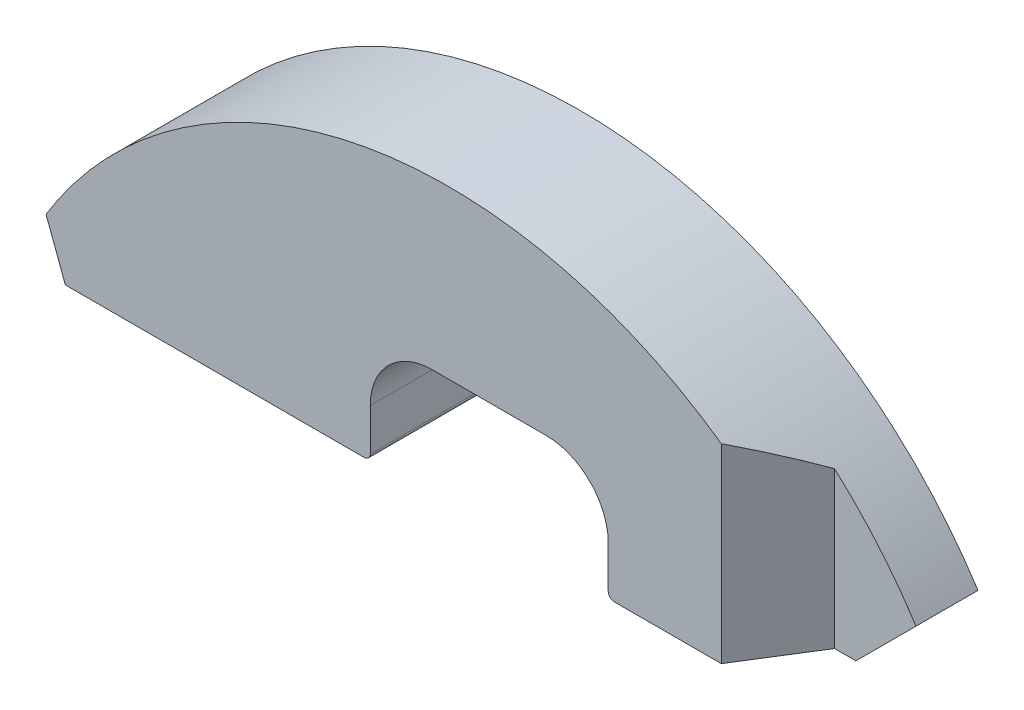
from build123d import *

# Parameters (mm, degrees)
BOSS_EXTRUDE1_DEPTH = 53.975
FILLET1_R           = 25.4
FILLET2_R           = 2.54
CHAMFER1_SIZE       = 38.1
CHAMFER2_SIZE       = 19.17726945
CUT_EXTRUDE2_DEPTH  = 221.930957303


with BuildPart() as part:
    # Sketch1 → Boss-Extrude1 (new body)
    with BuildSketch(Plane.XY):
        with BuildLine():
            Line((-48.768, 0), (-48.768, 45.106))
            Line((-48.768, 45.106), (48.768, 45.106))
            Line((48.768, 45.106), (48.768, 0))
            Line((48.768, 0), (159.817162922, 0))
            ThreePointArc((159.817162922, 0), (-16.571441881, 113.499698272), (-192.960046685, 0))
            Line((-192.960046685, 0), (-48.768, 0))
        make_face()
    extrude(amount=BOSS_EXTRUDE1_DEPTH)

    # Fillet1
    fillet1_edges = [part.edges().sort_by_distance(p)[0] for p in [
        (48.768, 45.106, 26.9875),
        (-48.768, 45.106, 26.9875),
    ]]
    fillet(fillet1_edges, radius=FILLET1_R)

    # Fillet2
    fillet2_edges = [part.edges().sort_by_distance(p)[0] for p in [
        (48.768, 0, 26.9875),
        (-48.768, 0, 26.9875),
    ]]
    fillet(fillet2_edges, radius=FILLET2_R)

    # Chamfer1
    # the kernel refuses this chamfer: 38.1, 28.765904175 mm, written as the material it takes off along each edge
    with BuildSketch(Plane(origin=(159.817162922, 0, -97.981121842), x_dir=(-0.47921828298651964, 0.8776957543770233, 0), z_dir=(0, 0, 1))) as chamfer1_piece_1:
        with BuildLine():
            Line((28.078418346, 0), (CHAMFER1_SIZE * 0.479218282987, CHAMFER1_SIZE * 0.877695754377))
            Line((CHAMFER1_SIZE * 0.479218282987, CHAMFER1_SIZE * 0.877695754377), (0, 0))
            ThreePointArc((0, 0), (14.253669202, -0.509031999), (28.078418346, 0))
        make_face()
    extrude(amount=249.937243683, mode=Mode.SUBTRACT)

    # Chamfer2
    # the kernel refuses this chamfer: 25.4, 19.17726945 mm, written as the material it takes off along each edge
    with BuildSketch(Plane(origin=(-192.960046685, 0, -61.621694141), x_dir=(1, 0, 0), z_dir=(0, 0, 1))) as chamfer2_piece_1:
        with BuildLine():
            Line((CHAMFER2_SIZE, 0), (11.259728132, 21.154322158))
            ThreePointArc((11.259728132, 21.154322158), (5.460860237, 11.048084579), (0, 0))
            Line((0, 0), (CHAMFER2_SIZE, 0))
        make_face()
    extrude(amount=177.218388283, mode=Mode.SUBTRACT)

    # Sketch2 → Cut-Extrude2 (cut, through all)
    with BuildSketch(Plane(origin=(0, 0, 0), x_dir=(1, 0, 0), z_dir=(0, 1, 0))):
        Polygon((112.968558119, -25.4), (49.468558119, -127), (163.768558119, -127), (163.768558119, -25.4), align=None)
    extrude(amount=CUT_EXTRUDE2_DEPTH, mode=Mode.SUBTRACT)


solid = part.part
